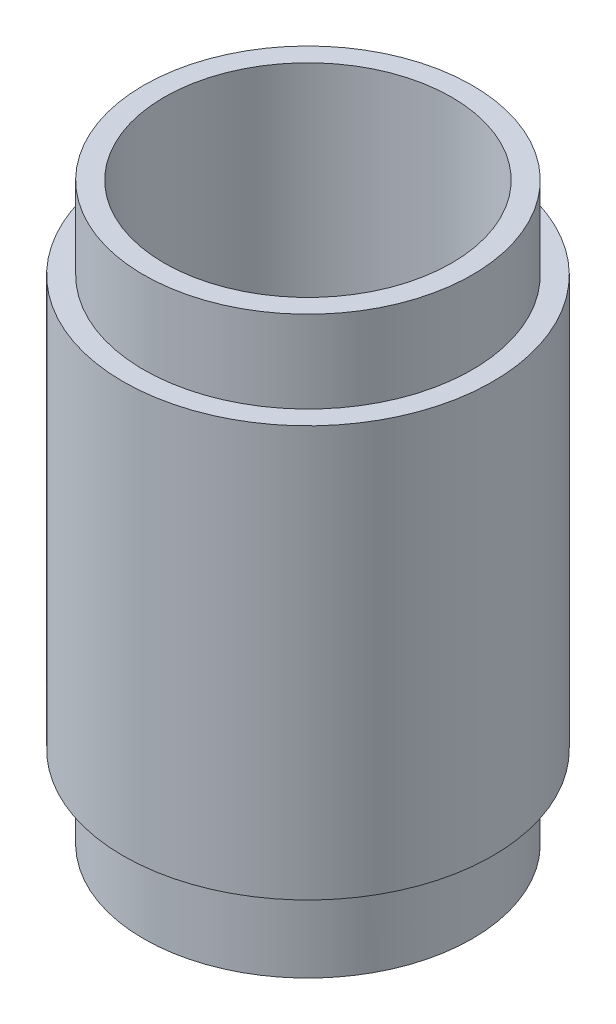
from build123d import *

# Parameters (mm, degrees)
F_3DSKETCH4_R       = 45
F_3DSKETCH4_R_2     = 35
BOSS_EXTRUDE3_DEPTH = 100
SKETCH3_R           = 40
SKETCH3_R_2         = 35
BOSS_EXTRUDE4_DEPTH = 20
BOSS_EXTRUDE5_START = 20
SKETCH4_R           = 40
SKETCH4_R_2         = 35
BOSS_EXTRUDE5_DEPTH = 20


with BuildPart() as part:
    # 3DSketch4 → Boss-Extrude3 (new body)
    with BuildSketch(Plane.ZX.offset(601)):
        Circle(F_3DSKETCH4_R)
        Circle(F_3DSKETCH4_R_2, mode=Mode.SUBTRACT)
    extrude(amount=BOSS_EXTRUDE3_DEPTH)

    # Sketch3 → Boss-Extrude4 (add)
    with BuildSketch(Plane(origin=(0, 701, 0), x_dir=(1, 0, 0), z_dir=(0, 1, 0))):
        Circle(SKETCH3_R)
        Circle(SKETCH3_R_2, mode=Mode.SUBTRACT)
    extrude(amount=BOSS_EXTRUDE4_DEPTH)

    # Sketch4 → Boss-Extrude5 (add)
    with BuildSketch(Plane.XZ.offset(-601).offset(BOSS_EXTRUDE5_START)):
        Circle(SKETCH4_R)
        Circle(SKETCH4_R_2, mode=Mode.SUBTRACT)
    extrude(amount=-BOSS_EXTRUDE5_DEPTH)


solid = part.part
